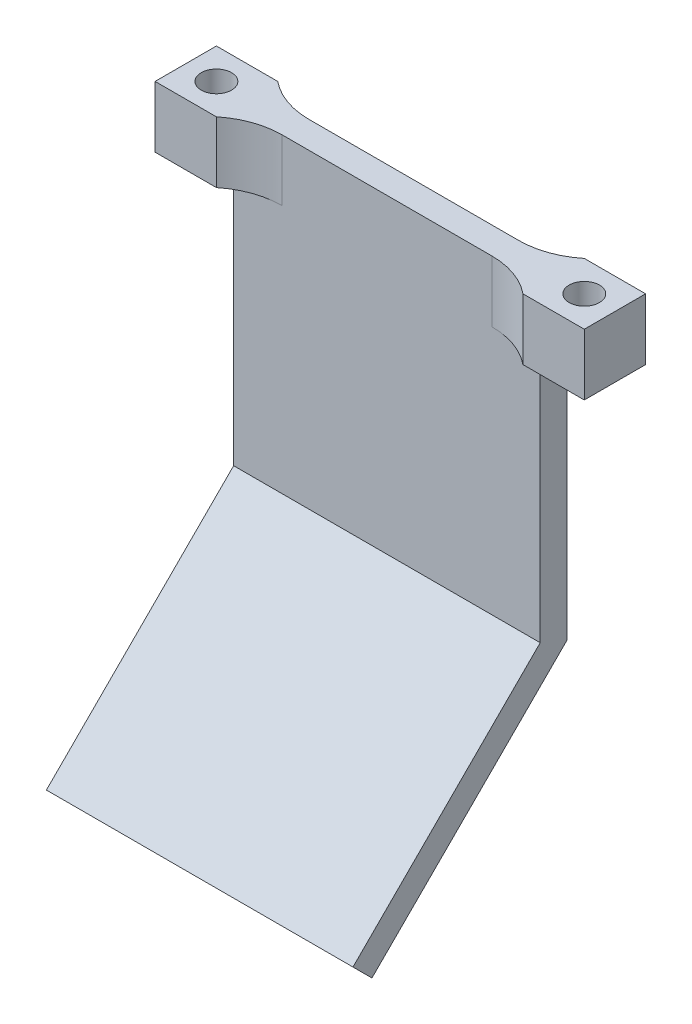
from build123d import *

# Parameters (mm, degrees)
EXTRUDE_1_DEPTH     = 40
SKETCH_4_W          = 8
SKETCH_4_H          = 8
EXTRUDE_2_DEPTH     = 8
SKETCH_5_R          = 1.98
CUT_EXTRUDE_2_DEPTH = 8
FILLET_1_R          = 10
FILLET_2_R          = 10
SKETCH_6_W          = 8
SKETCH_6_H          = 8
EXTRUDE_3_DEPTH     = 8
SKETCH_7_R          = 1.98
CUT_EXTRUDE_3_DEPTH = 8
FILLET_3_R          = 10
FILLET_4_R          = 10


with BuildPart() as part:
    # 草图2 → 凸台-拉伸1 (new body)
    with BuildSketch(Plane(origin=(0, 0, 0), x_dir=(0, 0, -1), z_dir=(1, 0, 0))):
        Polygon((0, 0), (0, -42), (-25.455844123, -67.455844123), (-27.930717857, -64.980970389), (-3.5, -40.550252532), (-3.5, 0), align=None)
    extrude(amount=EXTRUDE_1_DEPTH)

    # 草图4 → 凸台-拉伸2 (add)
    with BuildSketch(Plane.ZY):
        with Locations((1.75, -4)):
            Rectangle(SKETCH_4_W, SKETCH_4_H)
    extrude(amount=EXTRUDE_2_DEPTH)

    # 草图5 → 切除-拉伸2 (cut)
    with BuildSketch(Plane(origin=(0, 0, 0), x_dir=(1, 0, 0), z_dir=(0, 1, 0))):
        with Locations(Location((-4, -1.75, 0), (0, 0, 270))):
            Circle(SKETCH_5_R)
    extrude(amount=-CUT_EXTRUDE_2_DEPTH, mode=Mode.SUBTRACT)

    # 圆角1
    # the kernel refuses this fillet: 10 mm, written as the material it adds along each edge
    with BuildSketch(Plane(origin=(0, 0, 0), x_dir=(1, 0, 0), z_dir=(0, -1, 0))) as fillet_1_piece_1:
        with BuildLine():
            CenterArc((6.31961233, -10), FILLET_1_R, 90, 39.194967426)
            Line((0, -2.25), (0, 0))
            Line((0, 0), (6.31961233, 0))
        make_face()
    extrude(amount=8)

    # 圆角2
    # the kernel refuses this fillet: 10 mm, written as the material it adds along each edge
    with BuildSketch(Plane(origin=(0, -8, 3.5), x_dir=(1, 0, 0), z_dir=(0, 1, 0))) as fillet_2_piece_1:
        with BuildLine():
            CenterArc((6.31961233, -10), FILLET_2_R, 90, 39.194967426)
            Line((0, -2.25), (0, 0))
            Line((0, 0), (6.31961233, 0))
        make_face()
    extrude(amount=8)

    # 草图6 → 凸台-拉伸3 (add)
    with BuildSketch(Plane(origin=(40, 0, 0), x_dir=(0, 0, -1), z_dir=(1, 0, 0))):
        with Locations((-1.75, -4)):
            Rectangle(SKETCH_6_W, SKETCH_6_H)
    extrude(amount=EXTRUDE_3_DEPTH)

    # 草图7 → 切除-拉伸3 (cut)
    with BuildSketch(Plane(origin=(0, 0, 0), x_dir=(1, 0, 0), z_dir=(0, 1, 0))):
        with Locations(Location((44, -1.75, 0), (0, 0, 270))):
            Circle(SKETCH_7_R)
    extrude(amount=-CUT_EXTRUDE_3_DEPTH, mode=Mode.SUBTRACT)

    # 圆角3
    # the kernel refuses this fillet: 10 mm, written as the material it adds along each edge
    with BuildSketch(Plane(origin=(40, 0, 0), x_dir=(-1, 0, 0), z_dir=(0, -1, 0))) as fillet_3_piece_1:
        with BuildLine():
            CenterArc((6.31961233, 10), FILLET_3_R, 230.805032574, 39.194967426)
            Line((0, 2.25), (0, 0))
            Line((0, 0), (6.31961233, 0))
        make_face()
    extrude(amount=8)

    # 圆角4
    # the kernel refuses this fillet: 10 mm, written as the material it adds along each edge
    with BuildSketch(Plane(origin=(40, -8, 3.5), x_dir=(-1, 0, 0), z_dir=(0, 1, 0))) as fillet_4_piece_1:
        with BuildLine():
            CenterArc((6.31961233, 10), FILLET_4_R, 230.805032574, 39.194967426)
            Line((0, 2.25), (0, 0))
            Line((0, 0), (6.31961233, 0))
        make_face()
    extrude(amount=8)


solid = part.part
